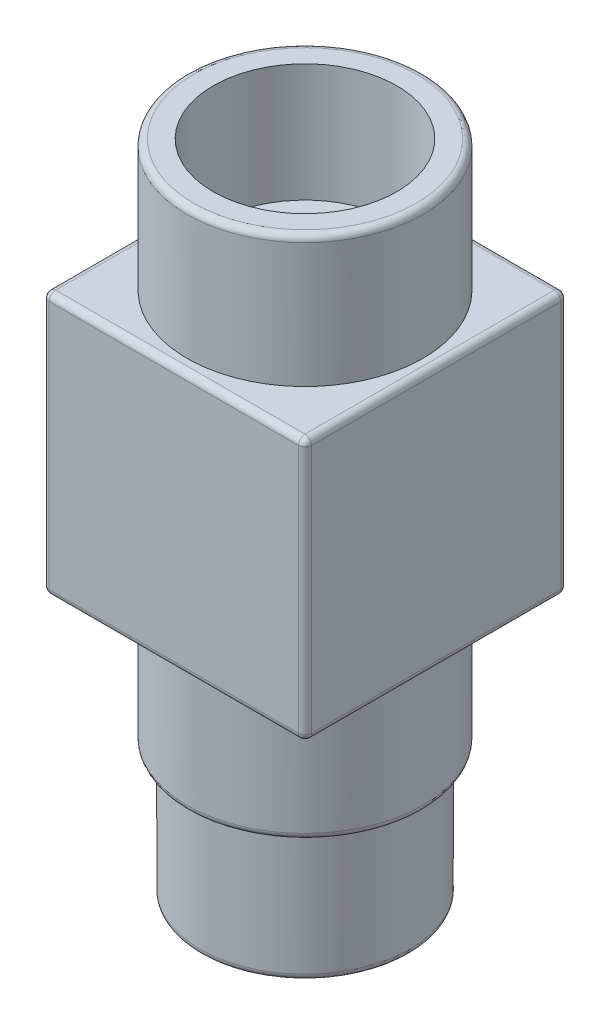
from build123d import *

# Parameters (mm, degrees)
CROQUIS1_W              = 40
CROQUIS1_H              = 40
SALIENTE_EXTRUIR2_DEPTH = 20
CROQUIS4_R              = 18
SALIENTE_EXTRUIR3_DEPTH = 40
REDONDEO1_R             = 1
CROQUIS5_R              = 16
SALIENTE_EXTRUIR4_DEPTH = 20
REDONDEO2_R             = 1
CROQUIS6_R              = 14
CORTAR_EXTRUIR1_DEPTH   = 18
CROQUIS7_R              = 10
CORTAR_EXTRUIR3_DEPTH   = 104.923048454
CROQUIS8_R              = 9.5
CORTAR_EXTRUIR4_DEPTH   = 18
REDONDEO3_R             = 1


with BuildPart() as part:
    # Croquis1 → Saliente-Extruir2 (new, symmetric)
    with BuildSketch(Plane(origin=(0, 0, 0), x_dir=(1, 0, 0), z_dir=(0, 1, 0))):
        Rectangle(CROQUIS1_W, CROQUIS1_H)
    extrude(amount=SALIENTE_EXTRUIR2_DEPTH, both=True)

    # Croquis4 → Saliente-Extruir3 (add, symmetric)
    with BuildSketch(Plane(origin=(0, 0, 0), x_dir=(1, 0, 0), z_dir=(0, 1, 0))):
        with Locations(Location((0, 0, 0), (0, 0, 90))):
            Circle(CROQUIS4_R)
    extrude(amount=SALIENTE_EXTRUIR3_DEPTH, both=True)

    # Redondeo1
    redondeo1_edges = [part.edges().sort_by_distance(p)[0] for p in [
        (-20, 20, 0),
        (0, 20, 20),
        (0, -40, 18),
        (0, 40, 18),
        (20, 20, 0),
        (0, -20, 20),
        (-20, -20, 0),
        (0, -20, -20),
        (20, -20, 0),
        (0, 20, -20),
    ]]
    fillet(redondeo1_edges, radius=REDONDEO1_R)

    # Croquis5 → Saliente-Extruir4 (add)
    with BuildSketch(Plane.XZ.offset(40)):
        with Locations(Location((0, 0, 0), (0, 0, 90))):
            Circle(CROQUIS5_R)
    extrude(amount=SALIENTE_EXTRUIR4_DEPTH)

    # Redondeo2
    redondeo2_edges = [part.edges().sort_by_distance(p)[0] for p in [
        (0, -60, -16),
    ]]
    fillet(redondeo2_edges, radius=REDONDEO2_R)

    # Croquis6 → Cortar-Extruir1 (cut)
    with BuildSketch(Plane(origin=(0, 40, 0), x_dir=(1, 0, 0), z_dir=(0, 1, 0))):
        with Locations(Location((0, 0, 0), (0, 0, 270))):
            Circle(CROQUIS6_R)
    extrude(amount=-CORTAR_EXTRUIR1_DEPTH, mode=Mode.SUBTRACT)

    # Croquis7 → Cortar-Extruir3 (cut, through all)
    with BuildSketch(Plane.XZ.offset(60)):
        with Locations(Location((0, 0, 0), (0, 0, 270))):
            Circle(CROQUIS7_R)
    extrude(amount=-CORTAR_EXTRUIR3_DEPTH, mode=Mode.SUBTRACT)

    # Croquis8 → Cortar-Extruir4 (cut)
    with BuildSketch(Plane.ZY.offset(20)):
        Circle(CROQUIS8_R)
    extrude(amount=-CORTAR_EXTRUIR4_DEPTH, mode=Mode.SUBTRACT)

    # Redondeo3
    # the kernel refuses this fillet: 1 mm, written as the material it takes off along each edge
    with BuildSketch(Plane(origin=(19, -19, 19), x_dir=(1, 0, 0), z_dir=(0, 0, 1))) as redondeo3_piece_1_section:
        Polygon((0, 0), (REDONDEO3_R, 0), (REDONDEO3_R, -REDONDEO3_R), (0, -REDONDEO3_R), align=None)
    redondeo3_piece_1 = extrude(amount=REDONDEO3_R, mode=Mode.PRIVATE)
    redondeo3_piece_1 = redondeo3_piece_1 - Plane(origin=(19, -19, 19), x_dir=(-0.7071067811865475, 0.7071067811865475, 0), z_dir=(0, 0, 1)) * Sphere(REDONDEO3_R, mode=Mode.PRIVATE)
    add(redondeo3_piece_1, mode=Mode.SUBTRACT)
    with BuildSketch(Plane(origin=(-19, -19, 19), x_dir=(0, 0, 1), z_dir=(-1, 0, 0))) as redondeo3_piece_2_section:
        Polygon((0, 0), (REDONDEO3_R, 0), (REDONDEO3_R, -REDONDEO3_R), (0, -REDONDEO3_R), align=None)
    redondeo3_piece_2 = extrude(amount=REDONDEO3_R, mode=Mode.PRIVATE)
    redondeo3_piece_2 = redondeo3_piece_2 - Plane(origin=(-19, -19, 19), x_dir=(0, 0.7071067811865475, -0.7071067811865475), z_dir=(-1, 0, 0)) * Sphere(REDONDEO3_R, mode=Mode.PRIVATE)
    add(redondeo3_piece_2, mode=Mode.SUBTRACT)
    with BuildSketch(Plane(origin=(19, -19, -19), x_dir=(1, 0, 0), z_dir=(0, 0, -1))) as redondeo3_piece_3_section:
        Polygon((0, 0), (REDONDEO3_R, 0), (REDONDEO3_R, REDONDEO3_R), (0, REDONDEO3_R), align=None)
    redondeo3_piece_3 = extrude(amount=REDONDEO3_R, mode=Mode.PRIVATE)
    redondeo3_piece_3 = redondeo3_piece_3 - Plane(origin=(19, -19, -19), x_dir=(-0.7071067811865475, 0.7071067811865475, 0), z_dir=(0, 0, -1)) * Sphere(REDONDEO3_R, mode=Mode.PRIVATE)
    add(redondeo3_piece_3, mode=Mode.SUBTRACT)
    with BuildSketch(Plane(origin=(-19, -19, -19), x_dir=(0, 0, -1), z_dir=(-1, 0, 0))) as redondeo3_piece_4_section:
        Polygon((0, 0), (REDONDEO3_R, 0), (REDONDEO3_R, REDONDEO3_R), (0, REDONDEO3_R), align=None)
    redondeo3_piece_4 = extrude(amount=REDONDEO3_R, mode=Mode.PRIVATE)
    redondeo3_piece_4 = redondeo3_piece_4 - Plane(origin=(-19, -19, -19), x_dir=(0, 0.7071067811865475, 0.7071067811865475), z_dir=(-1, 0, 0)) * Sphere(REDONDEO3_R, mode=Mode.PRIVATE)
    add(redondeo3_piece_4, mode=Mode.SUBTRACT)
    with BuildSketch(Plane(origin=(19, 19, 19), x_dir=(1, 0, 0), z_dir=(0, 0, 1))) as redondeo3_piece_5_section:
        Polygon((0, 0), (REDONDEO3_R, 0), (REDONDEO3_R, REDONDEO3_R), (0, REDONDEO3_R), align=None)
    redondeo3_piece_5 = extrude(amount=REDONDEO3_R, mode=Mode.PRIVATE)
    redondeo3_piece_5 = redondeo3_piece_5 - Plane(origin=(19, 19, 19), x_dir=(-0.7071067811865475, -0.7071067811865475, 0), z_dir=(0, 0, 1)) * Sphere(REDONDEO3_R, mode=Mode.PRIVATE)
    add(redondeo3_piece_5, mode=Mode.SUBTRACT)
    with BuildSketch(Plane(origin=(-19, 19, 19), x_dir=(0, 0, 1), z_dir=(-1, 0, 0))) as redondeo3_piece_6_section:
        Polygon((0, 0), (REDONDEO3_R, 0), (REDONDEO3_R, REDONDEO3_R), (0, REDONDEO3_R), align=None)
    redondeo3_piece_6 = extrude(amount=REDONDEO3_R, mode=Mode.PRIVATE)
    redondeo3_piece_6 = redondeo3_piece_6 - Plane(origin=(-19, 19, 19), x_dir=(0, -0.7071067811865475, -0.7071067811865475), z_dir=(-1, 0, 0)) * Sphere(REDONDEO3_R, mode=Mode.PRIVATE)
    add(redondeo3_piece_6, mode=Mode.SUBTRACT)
    with BuildSketch(Plane(origin=(19, 19, -19), x_dir=(1, 0, 0), z_dir=(0, 0, -1))) as redondeo3_piece_7_section:
        Polygon((0, 0), (REDONDEO3_R, 0), (REDONDEO3_R, -REDONDEO3_R), (0, -REDONDEO3_R), align=None)
    redondeo3_piece_7 = extrude(amount=REDONDEO3_R, mode=Mode.PRIVATE)
    redondeo3_piece_7 = redondeo3_piece_7 - Plane(origin=(19, 19, -19), x_dir=(-0.7071067811865475, -0.7071067811865475, 0), z_dir=(0, 0, -1)) * Sphere(REDONDEO3_R, mode=Mode.PRIVATE)
    add(redondeo3_piece_7, mode=Mode.SUBTRACT)
    with BuildSketch(Plane(origin=(-19, 19, -19), x_dir=(0, 0, -1), z_dir=(-1, 0, 0))) as redondeo3_piece_8_section:
        Polygon((0, 0), (REDONDEO3_R, 0), (REDONDEO3_R, -REDONDEO3_R), (0, -REDONDEO3_R), align=None)
    redondeo3_piece_8 = extrude(amount=REDONDEO3_R, mode=Mode.PRIVATE)
    redondeo3_piece_8 = redondeo3_piece_8 - Plane(origin=(-19, 19, -19), x_dir=(0, -0.7071067811865475, 0.7071067811865475), z_dir=(-1, 0, 0)) * Sphere(REDONDEO3_R, mode=Mode.PRIVATE)
    add(redondeo3_piece_8, mode=Mode.SUBTRACT)
    with BuildSketch(Plane(origin=(-20, 19, -20), x_dir=(0, 0, 1), z_dir=(0, -1, 0)), Plane(origin=(20, -19, 20), x_dir=(-1, 0, 0), z_dir=(0, 1, 0))) as redondeo3_piece_9:
        with BuildLine():
            CenterArc((REDONDEO3_R, -REDONDEO3_R), REDONDEO3_R, 90, 90)
            Line((0, -REDONDEO3_R), (0, 0))
            Line((0, 0), (REDONDEO3_R, 0))
        make_face()
    extrude(amount=38, mode=Mode.SUBTRACT)
    with BuildSketch(Plane(origin=(20, -19, -20), x_dir=(-1, 0, 0), z_dir=(0, 1, 0)), Plane(origin=(-20, 19, 20), x_dir=(0, 0, -1), z_dir=(0, -1, 0))) as redondeo3_piece_10:
        with BuildLine():
            CenterArc((REDONDEO3_R, REDONDEO3_R), REDONDEO3_R, 180, 90)
            Line((0, REDONDEO3_R), (0, 0))
            Line((0, 0), (REDONDEO3_R, 0))
        make_face()
    extrude(amount=38, mode=Mode.SUBTRACT)


solid = part.part
